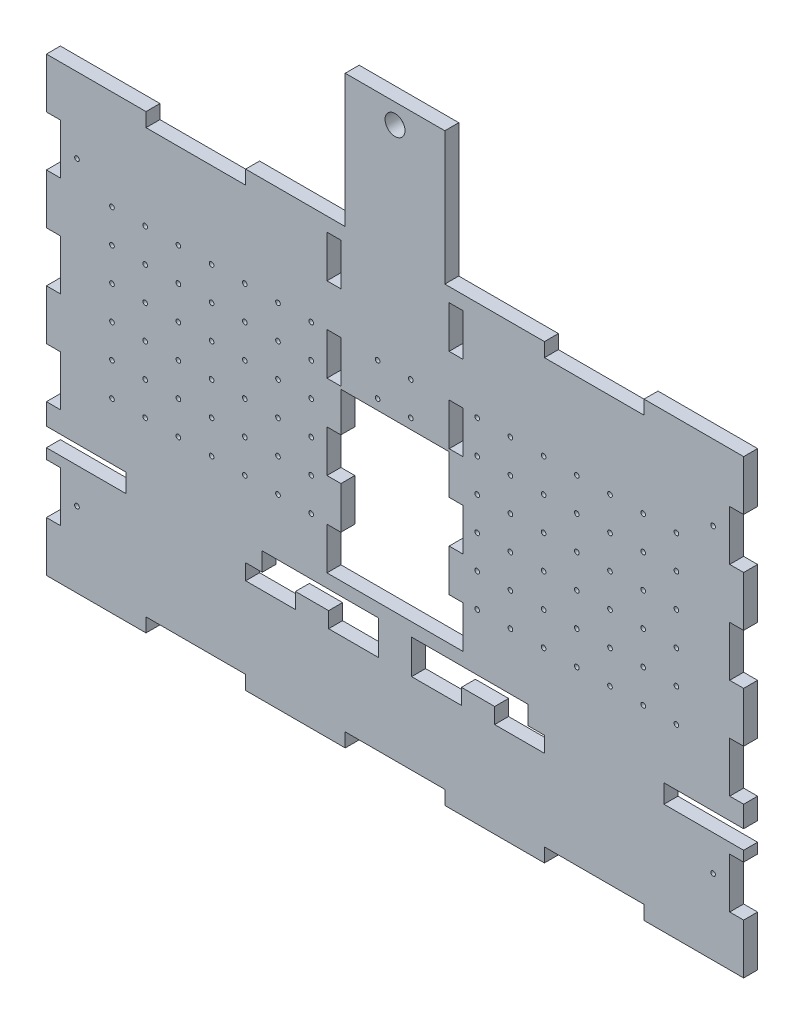
from build123d import *

# Parameters (mm, degrees)
SKETCH1_W           = 266.7
SKETCH1_H           = 172.72
BOSS_EXTRUDE1_DEPTH = 5.334
SKETCH2_W           = 38.1
SKETCH2_H           = 5.334
CUT_EXTRUDE1_DEPTH  = 165.701204222
SKETCH5_W           = 44.45
SKETCH5_H           = 7.112
CUT_EXTRUDE3_DEPTH  = 165.701204222
SKETCH9_W           = 5.334
SKETCH9_H           = 19.191111111
CUT_EXTRUDE7_DEPTH  = 165.701204222
SKETCH10_W          = 38.1
SKETCH10_H          = 5.334
BOSS_EXTRUDE2_DEPTH = 50.8
SKETCH11_W          = 6.604
SKETCH11_H          = 40.64
CUT_EXTRUDE8_DEPTH  = 197.710659379
SKETCH12_R          = 3.81
CUT_EXTRUDE9_DEPTH  = 197.710659379
SKETCH14_R          = 0.889
CUT_EXTRUDE11_DEPTH = 197.710659379
SKETCH15_W          = 6.604
SKETCH15_H          = 10.16
CUT_EXTRUDE12_DEPTH = 197.710659379
SKETCH16_W          = 41.402
SKETCH16_H          = 63.5
CUT_EXTRUDE13_DEPTH = 197.710659379
SKETCH17_W          = 5.334
SKETCH17_H          = 16.124650759
SKETCH17_H_2        = 16.124650758
CUT_EXTRUDE14_DEPTH = 197.710659379
SKETCH18_W          = 38.1
SKETCH18_H          = 56.134
BOSS_EXTRUDE3_DEPTH = 5.334
SKETCH19_W          = 34.756768033
SKETCH19_H          = 54.94363668
CUT_EXTRUDE15_DEPTH = 197.710659379
SKETCH20_R          = 3.81
CUT_EXTRUDE16_DEPTH = 197.710659379
SKETCH21_R          = 0.889
CUT_EXTRUDE17_DEPTH = 197.710659379
SKETCH22_W          = 19.05
SKETCH22_H          = 5.993691658
CUT_EXTRUDE18_DEPTH = 197.710659379


with BuildPart() as part:
    # Sketch1 → Boss-Extrude1 (new body)
    with BuildSketch(Plane.XY):
        with Locations((5.474099752, 2.104142138)):
            Rectangle(SKETCH1_W, SKETCH1_H)
    extrude(amount=BOSS_EXTRUDE1_DEPTH)

    # Sketch2 → Cut-Extrude1 (cut, through all)
    with BuildSketch(Plane.XY.offset(5.334)):
        with Locations((-70.725900248, -81.588857862)):
            Rectangle(SKETCH2_W, SKETCH2_H)
        with Locations((5.474099752, -81.588857862)):
            Rectangle(SKETCH2_W, SKETCH2_H)
        with Locations((81.674099752, -81.588857862)):
            Rectangle(SKETCH2_W, SKETCH2_H)
        with Locations((81.674099752, 85.797142138)):
            Rectangle(SKETCH2_W, SKETCH2_H)
        with Locations((5.474099752, 85.797142138)):
            Rectangle(SKETCH2_W, SKETCH2_H)
        with Locations((-70.725900248, 85.797142138)):
            Rectangle(SKETCH2_W, SKETCH2_H)
    extrude(amount=-CUT_EXTRUDE1_DEPTH, mode=Mode.SUBTRACT)

    # Sketch5 → Cut-Extrude3 (cut, through all)
    with BuildSketch(Plane.XY.offset(5.334)):
        with Locations((34.049099752, -38.378413173)):
            Rectangle(SKETCH5_W, SKETCH5_H)
        with Locations((-23.100900248, -38.378413173)):
            Rectangle(SKETCH5_W, SKETCH5_H)
        with Locations((-119.620900248, -38.378413173)):
            Rectangle(SKETCH5_W, SKETCH5_H)
        with Locations((130.569099752, -38.378413173)):
            Rectangle(SKETCH5_W, SKETCH5_H)
    extrude(amount=-CUT_EXTRUDE3_DEPTH, mode=Mode.SUBTRACT)

    # Sketch9 → Cut-Extrude7 (cut, through all)
    with BuildSketch(Plane.XY.offset(5.334)):
        with Locations((-125.208900248, -55.469191196)):
            Rectangle(SKETCH9_W, SKETCH9_H)
        with Locations((-125.208900248, -17.086968973)):
            Rectangle(SKETCH9_W, SKETCH9_H)
        with Locations((-125.208900248, 21.295253249)):
            Rectangle(SKETCH9_W, SKETCH9_H)
        with Locations((-125.208900248, 59.677475472)):
            Rectangle(SKETCH9_W, SKETCH9_H)
        with Locations((136.157099752, 59.677475472)):
            Rectangle(SKETCH9_W, SKETCH9_H)
        with Locations((136.157099752, 21.295253249)):
            Rectangle(SKETCH9_W, SKETCH9_H)
        with Locations((136.157099752, -17.086968973)):
            Rectangle(SKETCH9_W, SKETCH9_H)
        with Locations((136.157099752, -55.469191196)):
            Rectangle(SKETCH9_W, SKETCH9_H)
    extrude(amount=-CUT_EXTRUDE7_DEPTH, mode=Mode.SUBTRACT)

    # Sketch10 → Boss-Extrude2 (add)
    with BuildSketch(Plane(origin=(0, 88.464142138, 0), x_dir=(1, 0, 0), z_dir=(0, 1, 0))):
        with Locations((43.574099752, -2.667)):
            Rectangle(SKETCH10_W, SKETCH10_H)
    extrude(amount=BOSS_EXTRUDE2_DEPTH)

    # Sketch11 → Cut-Extrude8 (cut, through all)
    with BuildSketch(Plane(origin=(0, 0, 0), x_dir=(-1, 0, 0), z_dir=(0, 0, -1))):
        with Locations((-27.826099752, 108.784142138)):
            Rectangle(SKETCH11_W, SKETCH11_H)
    extrude(amount=-CUT_EXTRUDE8_DEPTH, mode=Mode.SUBTRACT)

    # Sketch12 → Cut-Extrude9 (cut, through all)
    with BuildSketch(Plane.XY.offset(5.334)):
        with Locations((43.574099752, 130.476471297)):
            Circle(SKETCH12_R)
    extrude(amount=-CUT_EXTRUDE9_DEPTH, mode=Mode.SUBTRACT)

    # Sketch14 → Cut-Extrude11 (cut, through all)
    with BuildSketch(Plane.XY.offset(5.334)):
        with Locations((-102.797588144, 50.364142138)):
            Circle(SKETCH14_R)
        with Locations((-90.097588144, 50.364142138)):
            Circle(SKETCH14_R)
        with Locations((-77.397588144, 50.364142138)):
            Circle(SKETCH14_R)
        with Locations((-64.697588144, 50.364142138)):
            Circle(SKETCH14_R)
        with Locations((-51.997588144, 50.364142138)):
            Circle(SKETCH14_R)
        with Locations((-39.297588144, 50.364142138)):
            Circle(SKETCH14_R)
        with Locations((-26.597588144, 50.364142138)):
            Circle(SKETCH14_R)
        with Locations((-1.197588144, 50.364142138)):
            Circle(SKETCH14_R)
        with Locations((11.502411856, 50.364142138)):
            Circle(SKETCH14_R)
        with Locations((36.902411856, 50.364142138)):
            Circle(SKETCH14_R)
        with Locations((49.602411856, 50.364142138)):
            Circle(SKETCH14_R)
        with Locations((62.302411856, 50.364142138)):
            Circle(SKETCH14_R)
        with Locations((75.002411856, 50.364142138)):
            Circle(SKETCH14_R)
        with Locations((87.702411856, 50.364142138)):
            Circle(SKETCH14_R)
        with Locations((100.402411856, 50.364142138)):
            Circle(SKETCH14_R)
        with Locations((113.102411856, 50.364142138)):
            Circle(SKETCH14_R)
        with Locations((-102.797588144, 37.664142138)):
            Circle(SKETCH14_R)
        with Locations((-90.097588144, 37.664142138)):
            Circle(SKETCH14_R)
        with Locations((-77.397588144, 37.664142138)):
            Circle(SKETCH14_R)
        with Locations((-64.697588144, 37.664142138)):
            Circle(SKETCH14_R)
        with Locations((-51.997588144, 37.664142138)):
            Circle(SKETCH14_R)
        with Locations((-39.297588144, 37.664142138)):
            Circle(SKETCH14_R)
        with Locations((-26.597588144, 37.664142138)):
            Circle(SKETCH14_R)
        with Locations((-1.197588144, 37.664142138)):
            Circle(SKETCH14_R)
        with Locations((11.502411856, 37.664142138)):
            Circle(SKETCH14_R)
        with Locations((36.902411856, 37.664142138)):
            Circle(SKETCH14_R)
        with Locations((49.602411856, 37.664142138)):
            Circle(SKETCH14_R)
        with Locations((62.302411856, 37.664142138)):
            Circle(SKETCH14_R)
        with Locations((75.002411856, 37.664142138)):
            Circle(SKETCH14_R)
        with Locations((87.702411856, 37.664142138)):
            Circle(SKETCH14_R)
        with Locations((100.402411856, 37.664142138)):
            Circle(SKETCH14_R)
        with Locations((113.102411856, 37.664142138)):
            Circle(SKETCH14_R)
        with Locations((-102.797588144, 24.964142138)):
            Circle(SKETCH14_R)
        with Locations((-90.097588144, 24.964142138)):
            Circle(SKETCH14_R)
        with Locations((-77.397588144, 24.964142138)):
            Circle(SKETCH14_R)
        with Locations((-64.697588144, 24.964142138)):
            Circle(SKETCH14_R)
        with Locations((-51.997588144, 24.964142138)):
            Circle(SKETCH14_R)
        with Locations((-39.297588144, 24.964142138)):
            Circle(SKETCH14_R)
        with Locations((-26.597588144, 24.964142138)):
            Circle(SKETCH14_R)
        with Locations((-1.197588144, 24.964142138)):
            Circle(SKETCH14_R)
        with Locations((11.502411856, 24.964142138)):
            Circle(SKETCH14_R)
        with Locations((36.902411856, 24.964142138)):
            Circle(SKETCH14_R)
        with Locations((49.602411856, 24.964142138)):
            Circle(SKETCH14_R)
        with Locations((62.302411856, 24.964142138)):
            Circle(SKETCH14_R)
        with Locations((75.002411856, 24.964142138)):
            Circle(SKETCH14_R)
        with Locations((87.702411856, 24.964142138)):
            Circle(SKETCH14_R)
        with Locations((100.402411856, 24.964142138)):
            Circle(SKETCH14_R)
        with Locations((113.102411856, 24.964142138)):
            Circle(SKETCH14_R)
        with Locations((-102.797588144, 12.264142138)):
            Circle(SKETCH14_R)
        with Locations((-90.097588144, 12.264142138)):
            Circle(SKETCH14_R)
        with Locations((-77.397588144, 12.264142138)):
            Circle(SKETCH14_R)
        with Locations((-64.697588144, 12.264142138)):
            Circle(SKETCH14_R)
        with Locations((-51.997588144, 12.264142138)):
            Circle(SKETCH14_R)
        with Locations((-39.297588144, 12.264142138)):
            Circle(SKETCH14_R)
        with Locations((-26.597588144, 12.264142138)):
            Circle(SKETCH14_R)
        with Locations((36.902411856, 12.264142138)):
            Circle(SKETCH14_R)
        with Locations((49.602411856, 12.264142138)):
            Circle(SKETCH14_R)
        with Locations((62.302411856, 12.264142138)):
            Circle(SKETCH14_R)
        with Locations((75.002411856, 12.264142138)):
            Circle(SKETCH14_R)
        with Locations((87.702411856, 12.264142138)):
            Circle(SKETCH14_R)
        with Locations((100.402411856, 12.264142138)):
            Circle(SKETCH14_R)
        with Locations((113.102411856, 12.264142138)):
            Circle(SKETCH14_R)
        with Locations((-102.797588144, -0.435857862)):
            Circle(SKETCH14_R)
        with Locations((-90.097588144, -0.435857862)):
            Circle(SKETCH14_R)
        with Locations((-77.397588144, -0.435857862)):
            Circle(SKETCH14_R)
        with Locations((-64.697588144, -0.435857862)):
            Circle(SKETCH14_R)
        with Locations((-51.997588144, -0.435857862)):
            Circle(SKETCH14_R)
        with Locations((-39.297588144, -0.435857862)):
            Circle(SKETCH14_R)
        with Locations((-26.597588144, -0.435857862)):
            Circle(SKETCH14_R)
        with Locations((-13.897588144, -0.435857862)):
            Circle(SKETCH14_R)
        with Locations((-1.197588144, -0.435857862)):
            Circle(SKETCH14_R)
        with Locations((11.502411856, -0.435857862)):
            Circle(SKETCH14_R)
        with Locations((24.202411856, -0.435857862)):
            Circle(SKETCH14_R)
        with Locations((36.902411856, -0.435857862)):
            Circle(SKETCH14_R)
        with Locations((49.602411856, -0.435857862)):
            Circle(SKETCH14_R)
        with Locations((62.302411856, -0.435857862)):
            Circle(SKETCH14_R)
        with Locations((75.002411856, -0.435857862)):
            Circle(SKETCH14_R)
        with Locations((87.702411856, -0.435857862)):
            Circle(SKETCH14_R)
        with Locations((100.402411856, -0.435857862)):
            Circle(SKETCH14_R)
        with Locations((113.102411856, -0.435857862)):
            Circle(SKETCH14_R)
        with Locations((-102.797588144, -13.135857862)):
            Circle(SKETCH14_R)
        with Locations((-90.097588144, -13.135857862)):
            Circle(SKETCH14_R)
        with Locations((-77.397588144, -13.135857862)):
            Circle(SKETCH14_R)
        with Locations((-64.697588144, -13.135857862)):
            Circle(SKETCH14_R)
        with Locations((-51.997588144, -13.135857862)):
            Circle(SKETCH14_R)
        with Locations((-39.297588144, -13.135857862)):
            Circle(SKETCH14_R)
        with Locations((-26.597588144, -13.135857862)):
            Circle(SKETCH14_R)
        with Locations((-13.897588144, -13.135857862)):
            Circle(SKETCH14_R)
        with Locations((-1.197588144, -13.135857862)):
            Circle(SKETCH14_R)
        with Locations((11.502411856, -13.135857862)):
            Circle(SKETCH14_R)
        with Locations((24.202411856, -13.135857862)):
            Circle(SKETCH14_R)
        with Locations((36.902411856, -13.135857862)):
            Circle(SKETCH14_R)
        with Locations((49.602411856, -13.135857862)):
            Circle(SKETCH14_R)
        with Locations((62.302411856, -13.135857862)):
            Circle(SKETCH14_R)
        with Locations((75.002411856, -13.135857862)):
            Circle(SKETCH14_R)
        with Locations((87.702411856, -13.135857862)):
            Circle(SKETCH14_R)
        with Locations((100.402411856, -13.135857862)):
            Circle(SKETCH14_R)
        with Locations((113.102411856, -13.135857862)):
            Circle(SKETCH14_R)
    extrude(amount=-CUT_EXTRUDE11_DEPTH, mode=Mode.SUBTRACT)

    # Sketch15 → Cut-Extrude12 (cut, through all)
    with BuildSketch(Plane.XY.offset(5.334)):
        with Locations((27.826099752, 134.184142138)):
            Rectangle(SKETCH15_W, SKETCH15_H)
    extrude(amount=-CUT_EXTRUDE12_DEPTH, mode=Mode.SUBTRACT)

    # Sketch16 → Cut-Extrude13 (cut, through all)
    with BuildSketch(Plane.XY.offset(5.334)):
        with Locations((5.474099752, 2.007586827)):
            Rectangle(SKETCH16_W, SKETCH16_H)
    extrude(amount=-CUT_EXTRUDE13_DEPTH, mode=Mode.SUBTRACT)

    # Sketch17 → Cut-Extrude14 (cut, through all)
    with BuildSketch(Plane.XY.offset(5.334)):
        with Locations((-17.893900248, -21.680087794)):
            Rectangle(SKETCH17_W, SKETCH17_H)
        with Locations((-17.893900248, 10.569213724)):
            Rectangle(SKETCH17_W, SKETCH17_H)
        with Locations((-17.893900248, 42.818515241)):
            Rectangle(SKETCH17_W, SKETCH17_H_2)
        with Locations((-17.893900248, 75.067816759)):
            Rectangle(SKETCH17_W, SKETCH17_H)
        with Locations((28.842099752, 75.067816759)):
            Rectangle(SKETCH17_W, SKETCH17_H)
        with Locations((28.842099752, 42.818515241)):
            Rectangle(SKETCH17_W, SKETCH17_H_2)
        with Locations((28.842099752, 10.569213724)):
            Rectangle(SKETCH17_W, SKETCH17_H)
        with Locations((28.842099752, -21.680087794)):
            Rectangle(SKETCH17_W, SKETCH17_H)
    extrude(amount=-CUT_EXTRUDE14_DEPTH, mode=Mode.SUBTRACT)

    # Sketch18 → Boss-Extrude3 (add)
    with BuildSketch(Plane.XY.offset(5.334)):
        with Locations((5.474099752, 111.197142138)):
            Rectangle(SKETCH18_W, SKETCH18_H)
    extrude(amount=-BOSS_EXTRUDE3_DEPTH)

    # Sketch19 → Cut-Extrude15 (cut, through all)
    with BuildSketch(Plane.XY.offset(5.334)):
        with Locations((48.506483768, 115.935960478)):
            Rectangle(SKETCH19_W, SKETCH19_H)
    extrude(amount=-CUT_EXTRUDE15_DEPTH, mode=Mode.SUBTRACT)

    # Sketch20 → Cut-Extrude16 (cut, through all)
    with BuildSketch(Plane.XY.offset(5.334)):
        with Locations((5.474099752, 131.644142138)):
            Circle(SKETCH20_R)
    extrude(amount=-CUT_EXTRUDE16_DEPTH, mode=Mode.SUBTRACT)

    # Sketch21 → Cut-Extrude17 (cut, through all)
    with BuildSketch(Plane.XY.offset(5.334)):
        with Locations((127.140099752, 59.677475471)):
            Circle(SKETCH21_R)
        with Locations((-116.191900248, 59.677475471)):
            Circle(SKETCH21_R)
        with Locations((-116.191900248, -55.469191196)):
            Circle(SKETCH21_R)
        with Locations((127.140099752, -55.469191196)):
            Circle(SKETCH21_R)
    extrude(amount=-CUT_EXTRUDE17_DEPTH, mode=Mode.SUBTRACT)

    # Sketch22 → Cut-Extrude18 (cut, through all)
    with BuildSketch(Plane(origin=(0, 0, 0), x_dir=(-1, 0, 0), z_dir=(0, 0, -1))):
        with Locations((-21.349099752, -44.931259002)):
            Rectangle(SKETCH22_W, SKETCH22_H)
        with Locations((-53.099099752, -44.931259002)):
            Rectangle(SKETCH22_W, SKETCH22_H)
        with Locations((42.150900248, -44.931259002)):
            Rectangle(SKETCH22_W, SKETCH22_H)
        with Locations((10.400900248, -44.931259002)):
            Rectangle(SKETCH22_W, SKETCH22_H)
    extrude(amount=-CUT_EXTRUDE18_DEPTH, mode=Mode.SUBTRACT)


solid = part.part
